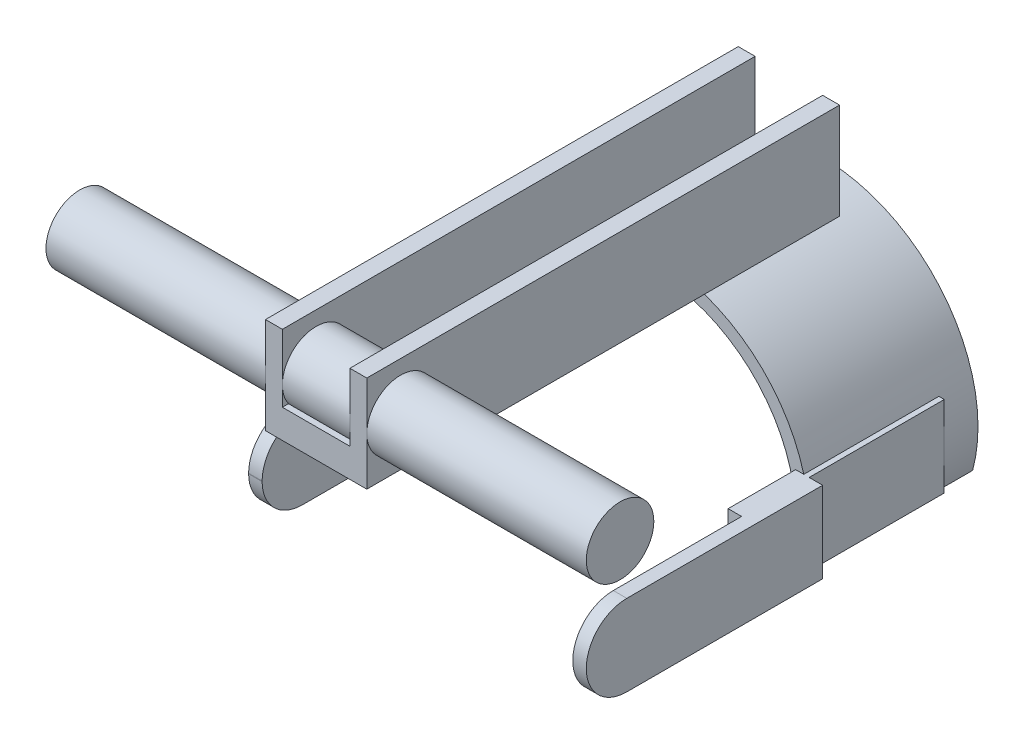
from build123d import *

# Parameters (mm, degrees)
EXTRUDE_1_DEPTH     = 50
SKETCH_3_W          = 4
SKETCH_3_H          = 24
EXTRUDE_2_DEPTH     = 70
SKETCH_5_R          = 80
SKETCH_5_R_2        = 46
CUT_EXTRUDE_2_DEPTH = 10
EXTRUDE_4_DEPTH     = 140
SKETCH_10_R         = 10
EXTRUDE_5_DEPTH     = 80
SKETCH_12_W         = 4
SKETCH_12_H         = 70
EXTRUDE_6_DEPTH     = 24
CUT_EXTRUDE_3_DEPTH = 212.149236324


with BuildPart() as part:
    # 草图2 → 凸台-拉伸1 (new body)
    with BuildSketch(Plane.XY):
        with BuildLine():
            Line((-46, 0), (-42, 0))
            ThreePointArc((-42, 0), (0, 42), (42, 0))
            Line((42, 0), (46, 0))
            ThreePointArc((46, 0), (37.456641601, 26.702059846), (15, 43.48562981))
            Line((15, 43.48562981), (15, 72))
            Line((15, 72), (10, 72))
            Line((10, 72), (10, 52))
            Line((10, 52), (-10, 52))
            Line((-10, 52), (-10, 72))
            Line((-10, 72), (-15, 72))
            Line((-15, 72), (-15, 43.48562981))
            ThreePointArc((-15, 43.48562981), (-37.456641601, 26.702059846), (-46, 0))
        make_face()
    extrude(amount=EXTRUDE_1_DEPTH)

    # 草图3 → 凸台-拉伸2 (add)
    with BuildSketch(Plane(origin=(0, 0, 0), x_dir=(-1, 0, 0), z_dir=(0, 0, -1))):
        with Locations((-44, 0)):
            Rectangle(SKETCH_3_W, SKETCH_3_H)
        with Locations((44, 0)):
            Rectangle(SKETCH_3_W, SKETCH_3_H)
    extrude(amount=-EXTRUDE_2_DEPTH)

    # 草图5 → 切除-拉伸2 (cut)
    with BuildSketch(Plane(origin=(0, 0, 0), x_dir=(-1, 0, 0), z_dir=(0, 0, -1))):
        Circle(SKETCH_5_R)
        Circle(SKETCH_5_R_2, mode=Mode.SUBTRACT)
    extrude(amount=-CUT_EXTRUDE_2_DEPTH, mode=Mode.SUBTRACT)

    # 草图9 → 凸台-拉伸4 (add)
    with BuildSketch(Plane(origin=(0, 0, 10), x_dir=(-1, 0, 0), z_dir=(0, 0, -1))):
        Polygon((-15, 72), (-15, 43.48562981), (15, 43.48562981), (15, 72), (10, 72), (10, 52), (-10, 52), (-10, 72), align=None)
    extrude(amount=-EXTRUDE_4_DEPTH)

    # 草图10 → 凸台-拉伸5 (add, symmetric)
    with BuildSketch(Plane(origin=(0, 0, 0), x_dir=(0, 0, -1), z_dir=(1, 0, 0))):
        with Locations((-140, 57.742814905)):
            Circle(SKETCH_10_R)
    extrude(amount=EXTRUDE_5_DEPTH, both=True)

    # 草图12 → 凸台-拉伸6 (add)
    with BuildSketch(Plane.XZ.offset(12)):
        with Locations((-48, 84.999732959)):
            Rectangle(SKETCH_12_W, SKETCH_12_H)
        with Locations((48, 85)):
            Rectangle(SKETCH_12_W, SKETCH_12_H)
    extrude(amount=-EXTRUDE_6_DEPTH)

    # 草图13 → 切除-拉伸3 (cut, through all)
    with BuildSketch(Plane.ZY.offset(50)):
        with BuildLine():
            Line((108, 12), (128.196913472, 12))
            Line((128.196913472, 12), (128.196913472, -12))
            Line((128.196913472, -12), (108, -12))
            ThreePointArc((108, -12), (120, 0), (108, 12))
        make_face()
    extrude(amount=-CUT_EXTRUDE_3_DEPTH, mode=Mode.SUBTRACT)


solid = part.part
